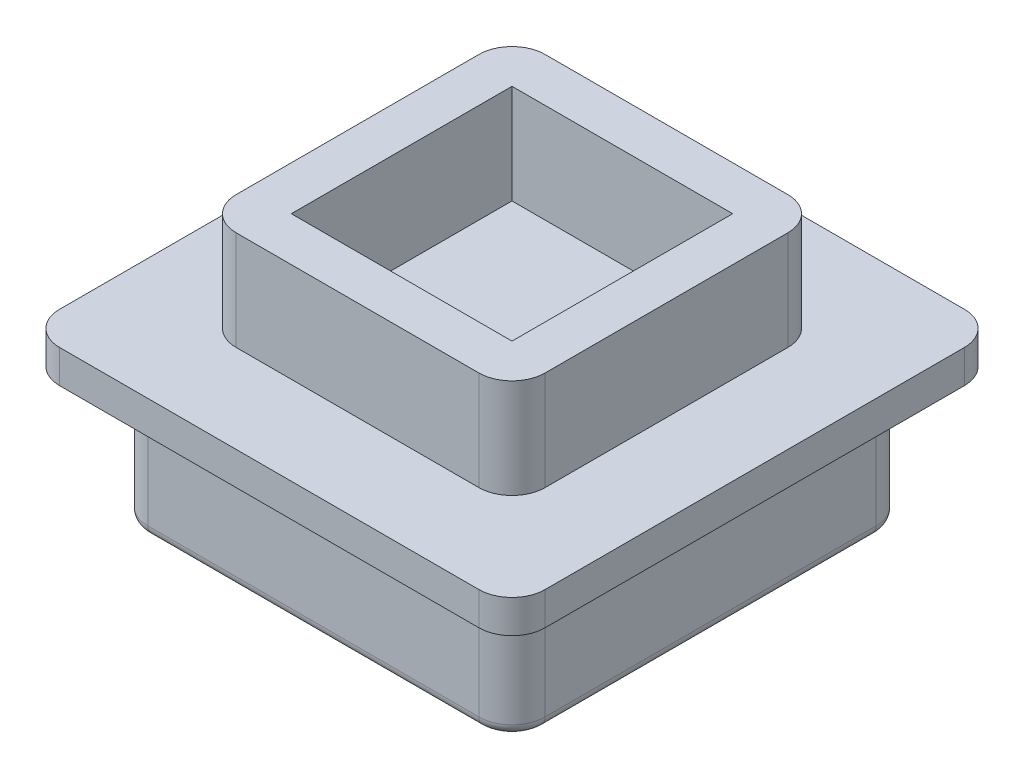
from build123d import *

# Parameters (mm, degrees)
SKETCH1_W           = 9
SKETCH1_H           = 9
BOSS_EXTRUDE1_DEPTH = 3
SKETCH2_W           = 11
SKETCH2_H           = 11
BOSS_EXTRUDE2_DEPTH = 0.75
SKETCH3_W           = 7
SKETCH3_H           = 7
SKETCH3_W_2         = 5
SKETCH3_H_2         = 5
BOSS_EXTRUDE3_DEPTH = 2.25
FILLET1_R           = 0.75
FILLET2_R           = 0.25


with BuildPart() as part:
    # Sketch1 → Boss-Extrude1 (new body)
    with BuildSketch(Plane(origin=(0, 0, 0), x_dir=(1, 0, 0), z_dir=(0, 1, 0))):
        Rectangle(SKETCH1_W, SKETCH1_H)
    extrude(amount=BOSS_EXTRUDE1_DEPTH)

    # Sketch2 → Boss-Extrude2 (add)
    with BuildSketch(Plane(origin=(0, 3, 0), x_dir=(1, 0, 0), z_dir=(0, 1, 0))):
        Rectangle(SKETCH2_W, SKETCH2_H)
    extrude(amount=BOSS_EXTRUDE2_DEPTH)

    # Sketch3 → Boss-Extrude3 (add)
    with BuildSketch(Plane(origin=(0, 3.75, 0), x_dir=(1, 0, 0), z_dir=(0, 1, 0))):
        Rectangle(SKETCH3_W, SKETCH3_H)
        Rectangle(SKETCH3_W_2, SKETCH3_H_2, mode=Mode.SUBTRACT)
    extrude(amount=BOSS_EXTRUDE3_DEPTH)

    # Fillet1
    fillet1_edges = [part.edges().sort_by_distance(p)[0] for p in [
        (-3.5, 4.875, 3.5),
        (-3.5, 4.875, -3.5),
        (3.5, 4.875, -3.5),
        (3.5, 4.875, 3.5),
        (5.5, 3.375, 5.5),
        (-5.5, 3.375, 5.5),
        (-5.5, 3.375, -5.5),
        (5.5, 3.375, -5.5),
        (4.5, 1.5, -4.5),
        (-4.5, 1.5, -4.5),
        (-4.5, 1.5, 4.5),
        (4.5, 1.5, 4.5),
    ]]
    fillet(fillet1_edges, radius=FILLET1_R)

    # Fillet2
    fillet2_edges = [part.edges().sort_by_distance(p)[0] for p in [
        (4.280330086, 0, -4.280330086),
        (4.5, 0, 0),
        (4.280330086, 0, 4.280330086),
        (0, 0, 4.5),
        (-4.280330086, 0, 4.280330086),
        (-4.5, 0, 0),
        (-4.280330086, 0, -4.280330086),
        (0, 0, -4.5),
    ]]
    fillet(fillet2_edges, radius=FILLET2_R)


solid = part.part
